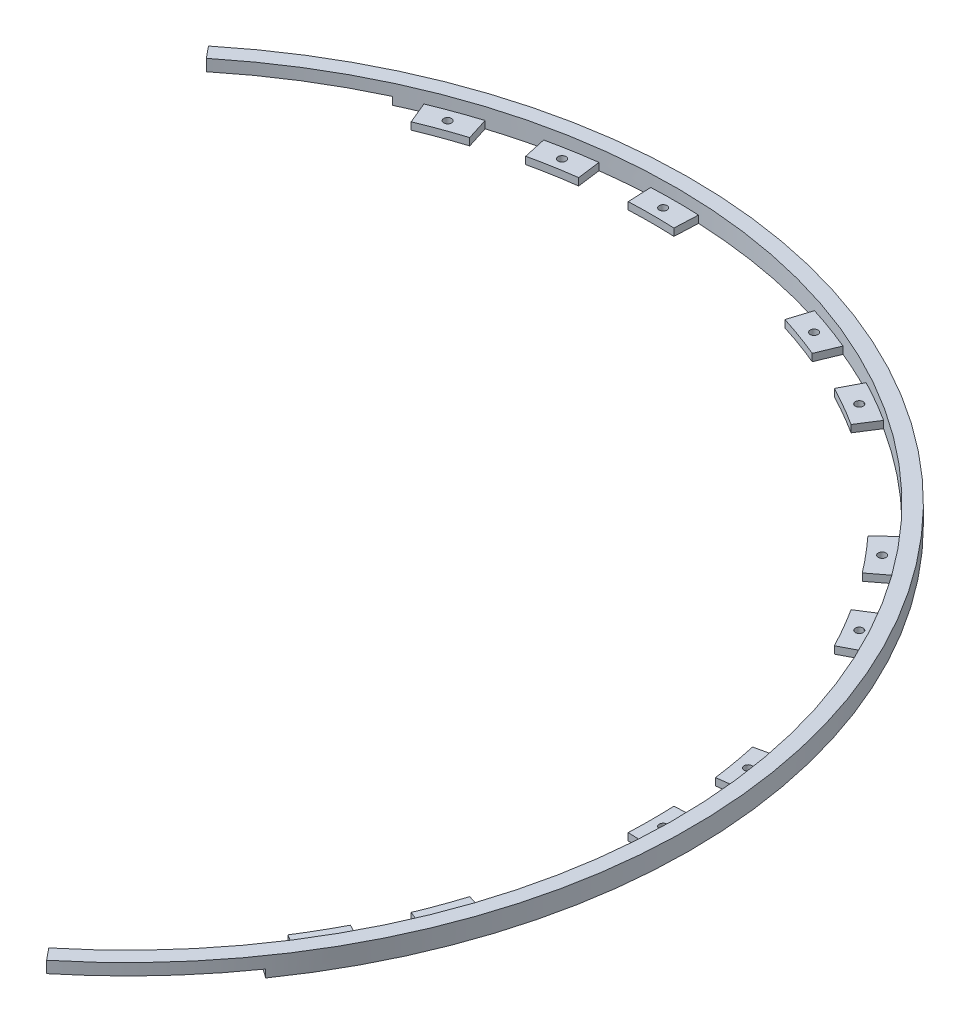
from build123d import *

# Parameters (mm, degrees)
F_3_8_CLEARANCE_HOLE1_D = 10.31748
CUT_EXTRUDE1_DEPTH      = 1044.898713202
CIRPATTERN1_COUNT       = 36
CUT_EXTRUDE_THIN1_START = -10.16
CUT_EXTRUDE_THIN1_DEPTH = 1055.247002027
CIRPATTERN3_COUNT       = 2
CUT_EXTRUDE3_DEPTH      = 1045.087002027
CUT_EXTRUDE4_DEPTH      = 1045.087002027


with BuildPart() as part:
    # Sketch1 → Revolve1 (revolve)
    with BuildSketch(Plane.XY, mode=Mode.PRIVATE) as revolve1_sk:
        Polygon((687.262499996, 0), (687.262499996, -9.525), (738.062499996, -9.525), (738.062499996, 0), (738.062499996, 15.875), (718.17500002, 15.875), (718.17500002, 0), align=None)
    revolve(revolve1_sk.sketch.rotate(Axis((0, 57.350368034, 0), (0, -1, 0)), 90), axis=Axis((0, 57.350368034, 0), (0, -1, 0)))

    # 3/8 Clearance Hole1 (through all)
    with Locations(Plane(origin=(0, 0, 0), x_dir=(1, 0, 0), z_dir=(0, 1, 0))):
        with Locations((702.500000128, 0)):
            f_3_8_clearance_hole1 = Hole(F_3_8_CLEARANCE_HOLE1_D / 2)

    # Sketch16 → Cut-Extrude1 (cut, through all)
    with BuildSketch(Plane(origin=(0, 0, 0), x_dir=(1, 0, 0), z_dir=(0, 1, 0))):
        with BuildLine():
            Line((712.030913337, -93.7406481), (681.382874036, -89.70575718))
            Line((681.382874036, -89.70575718), (0, 0))
            Line((0, 0), (686.608378381, -29.977969209))
            Line((686.608378381, -29.977969209), (717.491456555, -31.326353522))
            ThreePointArc((717.491456555, -31.326353522), (715.442127322, -62.59307555), (712.030913337, -93.7406481))
        make_face()
    cut_extrude1 = extrude(amount=-CUT_EXTRUDE1_DEPTH, mode=Mode.SUBTRACT)

    # CirPattern1: 3/8 Clearance Hole1, Cut-Extrude1 ×36 about axis
    cirpattern1_axis = Axis((0, 0, 0), (0, 1, 0))
    add([f_3_8_clearance_hole1.rotate(cirpattern1_axis, i * 360 / CIRPATTERN1_COUNT) for i in range(1, CIRPATTERN1_COUNT)], mode=Mode.SUBTRACT)
    add([cut_extrude1.rotate(cirpattern1_axis, i * 360 / CIRPATTERN1_COUNT) for i in range(1, CIRPATTERN1_COUNT)], mode=Mode.SUBTRACT)

    # Sketch18 → Cut-Extrude-Thin1 (cut)
    with BuildSketch(Plane.XZ.offset(9.525).offset(CUT_EXTRUDE_THIN1_START)):
        with BuildLine():
            ThreePointArc((314.248373982, 673.907812764), (477.960796886, 569.611496808), (609.100981349, 426.497098671))
            Line((609.100981349, 426.497098671), (557.084826536, 390.074994963))
            ThreePointArc((557.084826536, 390.074994963), (437.14378367, 520.967674669), (287.412114362, 616.357268287))
            Line((287.412114362, 616.357268287), (314.248373982, 673.907812764))
        make_face()
    cut_extrude_thin1 = extrude(amount=CUT_EXTRUDE_THIN1_DEPTH, mode=Mode.SUBTRACT)

    # CirPattern3: Cut-Extrude-Thin1 ×2 about axis
    cirpattern3_axis = Axis((0, 0, 0), (0, 1, 0))
    for i in range(1, CIRPATTERN3_COUNT):
        add(cut_extrude_thin1.rotate(cirpattern3_axis, i * 360 / CIRPATTERN3_COUNT), mode=Mode.SUBTRACT)

    # Sketch41 → Cut-Extrude3 (cut, through all)
    with BuildSketch(Plane.XZ.offset(9.525)):
        with BuildLine():
            Line((693.703780314, 185.877367722), (663.844598186, 177.876623984))
            ThreePointArc((663.844598186, 177.876623984), (676.821438351, 119.341880703), (684.647258693, 59.89887365))
            Line((684.647258693, 59.89887365), (715.442127322, 62.59307555))
            ThreePointArc((715.442127322, 62.59307555), (707.264308039, 124.709779999), (693.703780314, 185.877367722))
        make_face()
        with BuildLine():
            Line((693.703780314, -185.877367722), (663.844598186, -177.876623984))
            ThreePointArc((663.844598186, -177.876623984), (645.815499789, -235.057618751), (622.871355485, -290.449683108))
            Line((622.871355485, -290.449683108), (650.887594973, -303.513870134))
            ThreePointArc((650.887594973, -303.513870134), (674.863747952, -245.63031644), (693.703780314, -185.877367722))
        make_face()
        with BuildLine():
            Line((507.826412593, -507.826412593), (485.967974202, -485.967974202))
            ThreePointArc((485.967974202, -485.967974202), (441.7638196, -526.473619086), (394.197575585, -562.972481835))
            Line((394.197575585, -562.972481835), (411.928257188, -588.294519424))
            ThreePointArc((411.928257188, -588.294519424), (461.633991599, -550.153967952), (507.826412593, -507.826412593))
        make_face()
        with BuildLine():
            Line((185.877367722, -693.703780314), (177.876623984, -663.844598186))
            ThreePointArc((177.876623984, -663.844598186), (119.341880703, -676.821438351), (59.89887365, -684.647258693))
            Line((59.89887365, -684.647258693), (62.593075549, -715.442127322))
            ThreePointArc((62.593075549, -715.442127322), (124.709779999, -707.264308039), (185.877367722, -693.703780314))
        make_face()
        with BuildLine():
            Line((-693.703780315, -185.877367721), (-663.844598186, -177.876623984))
            ThreePointArc((-663.844598186, -177.876623984), (-676.821438351, -119.341880703), (-684.647258693, -59.89887365))
            Line((-684.647258693, -59.89887365), (-715.442127322, -62.593075549))
            ThreePointArc((-715.442127322, -62.593075549), (-707.264308039, -124.709779999), (-693.703780315, -185.877367721))
        make_face()
        with BuildLine():
            Line((-693.703780314, 185.877367722), (-663.844598186, 177.876623984))
            ThreePointArc((-663.844598186, 177.876623984), (-645.815499789, 235.057618751), (-622.871355485, 290.449683108))
            Line((-622.871355485, 290.449683108), (-650.887594973, 303.513870134))
            ThreePointArc((-650.887594973, 303.513870134), (-674.863747952, 245.63031644), (-693.703780314, 185.877367722))
        make_face()
        with BuildLine():
            Line((-507.826412593, 507.826412593), (-485.967974202, 485.967974203))
            ThreePointArc((-485.967974202, 485.967974203), (-441.763819599, 526.473619086), (-394.197575585, 562.972481835))
            Line((-394.197575585, 562.972481835), (-411.928257188, 588.294519424))
            ThreePointArc((-411.928257188, 588.294519424), (-461.633991599, 550.153967952), (-507.826412593, 507.826412593))
        make_face()
        with BuildLine():
            Line((-185.877367721, 693.703780315), (-177.876623983, 663.844598186))
            ThreePointArc((-177.876623983, 663.844598186), (-119.341880703, 676.821438351), (-59.898873649, 684.647258693))
            Line((-59.898873649, 684.647258693), (-62.593075549, 715.442127322))
            ThreePointArc((-62.593075549, 715.442127322), (-124.709779999, 707.264308039), (-185.877367721, 693.703780315))
        make_face()
    extrude(amount=-CUT_EXTRUDE3_DEPTH, mode=Mode.SUBTRACT)

    # Sketch42 → Cut-Extrude4 (cut, through all)
    with BuildSketch(Plane(origin=(0, 15.875, 0), x_dir=(1, 0, 0), z_dir=(0, 1, 0))):
        with BuildLine():
            ThreePointArc((-466.098832167, 572.265788383), (-572.265788383, -466.098832167), (466.098832167, -572.265788383))
            Line((466.098832167, -572.265788383), (453.539542793, -556.845771985))
            ThreePointArc((453.539542793, -556.845771984), (240.689237761, -676.64172313), (0, -718.17500002))
            ThreePointArc((0, -718.17500002), (-31.326353522, -717.491456555), (-62.593075549, -715.442127322))
            ThreePointArc((-62.593075549, -715.442127322), (-124.709779999, -707.264308039), (-185.877367721, -693.703780315))
            ThreePointArc((-185.877367721, -693.703780315), (-303.513870134, -650.887594973), (-411.928257188, -588.294519424))
            ThreePointArc((-411.928257188, -588.294519424), (-461.633991599, -550.153967952), (-507.826412593, -507.826412593))
            ThreePointArc((-507.826412593, -507.826412593), (-588.294519423, -411.928257188), (-650.887594973, -303.513870134))
            ThreePointArc((-650.887594973, -303.513870134), (-674.863747952, -245.63031644), (-693.703780314, -185.877367722))
            ThreePointArc((-693.703780314, -185.877367722), (-715.442127322, -62.59307555), (-715.442127322, 62.593075549))
            ThreePointArc((-715.442127322, 62.593075549), (-707.264308039, 124.709779999), (-693.703780315, 185.877367721))
            ThreePointArc((-693.703780315, 185.877367721), (-602.864993049, 390.293646899), (-453.539542793, 556.845771984))
            Line((-453.539542793, 556.845771985), (-466.098832167, 572.265788383))
        make_face()
    extrude(amount=-CUT_EXTRUDE4_DEPTH, mode=Mode.SUBTRACT)


with BuildPart() as cut_extrude4_kept_piece:
    # of the separate pieces the step leaves, the one the design keeps (cut_extrude4_pieces_kept)
    add(part.part.solids().sort_by_distance((-311.918690804, -9.525, -668.911791066))[0])


solid = cut_extrude4_kept_piece.part
